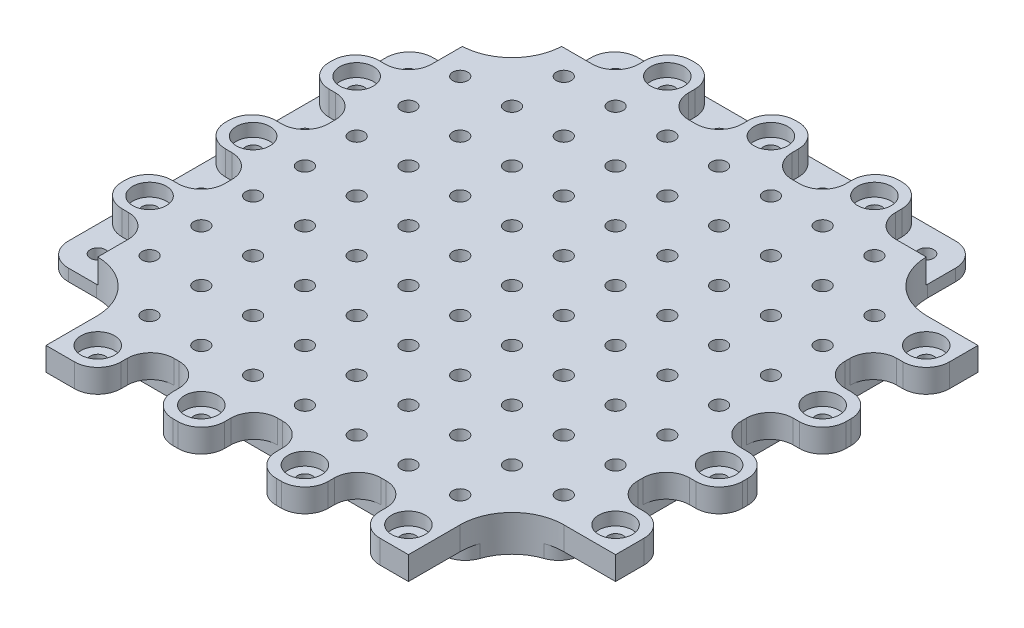
from build123d import *

# Parameters (mm, degrees)
CROQUIS1_W              = 100
CROQUIS1_H              = 100
SALIENTE_EXTRUIR1_DEPTH = 7
CROQUIS2_W              = 10.400000000000006
CROQUIS2_H              = 10.399999999999999
CROQUIS2_W_2            = 10.399999999999999
CROQUIS2_H_2            = 10.400000000000002
CORTAR_EXTRUIR1_DEPTH   = 4.7
CROQUIS3_W              = 9.999999999999986
CROQUIS3_H              = 10.000000000000004
CROQUIS3_W_2            = 10
CROQUIS3_H_2            = 10
CROQUIS3_W_3            = 10.000000000000007
CROQUIS3_H_3            = 10.000000000000002
CROQUIS3_W_4            = 10.000000000000004
CROQUIS3_H_4            = 10.000000000000014
CROQUIS3_W_5            = 10.000000000000002
SALIENTE_EXTRUIR2_DEPTH = 4.5
CROQUIS4_R              = 1.45
CORTAR_EXTRUIR2_DEPTH   = 7
CROQUIS5_R              = 3.2500000000000013
CORTAR_EXTRUIR4_DEPTH   = 2.5
CROQUIS6_W              = 10.000000000000007
CROQUIS6_H              = 0.19999999999999574
CROQUIS6_W_2            = 10.000000000000009
CROQUIS6_H_2            = 0.20000000000000284
CROQUIS6_W_3            = 10.00000000000001
CORTAR_EXTRUIR5_DEPTH   = 7
CROQUIS8_W              = 10.199999999999442
CROQUIS8_H              = 10
CORTAR_EXTRUIR7_DEPTH   = 7
CROQUIS9_W              = 10.012239445081292
CROQUIS9_H              = 0.19999999999999574
CROQUIS9_W_2            = 10.012239445081295
CROQUIS9_W_3            = 10.01223944508129
CROQUIS9_W_4            = 10.012239445081288
CORTAR_EXTRUIR9_DEPTH   = 2.5
CORTAR_EXTRUIR11_DEPTH  = 5
CROQUIS11_W             = 10
CROQUIS11_H             = 10.199999999999449
CROQUIS11_W_2           = 10.200000000000003
CROQUIS11_H_2           = 10.199999999999996
CORTAR_EXTRUIR12_DEPTH  = 10
CROQUIS12_W             = 19.800000000000004
CROQUIS12_H             = 19.8
CROQUIS12_W_2           = 9.800000000000836
CROQUIS12_H_2           = 20.000000000000014
CROQUIS12_W_3           = 20.00000000000001
CROQUIS12_H_3           = 9.600000000000563
CORTAR_EXTRUIR13_DEPTH  = 10
REDONDEO1_R             = 10
REDONDEO2_R             = 4.5
REDONDEO3_R             = 4.5


with BuildPart() as part:
    # Croquis1 → Saliente-Extruir1 (new body)
    with BuildSketch(Plane(origin=(0, 0, 0), x_dir=(1, 0, 0), z_dir=(0, 1, 0))):
        Rectangle(CROQUIS1_W, CROQUIS1_H)
    extrude(amount=SALIENTE_EXTRUIR1_DEPTH)

    # Croquis2 → Cortar-Extruir1 (cut)
    with BuildSketch(Plane(origin=(0, 7, 0), x_dir=(1, 0, 0), z_dir=(0, 1, 0))):
        Polygon((-50.19999999999998, 50.20000000000001), (-39.79999999999998, 50.20000000000001), (-39.79999999999998, 39.80000000000001), (-50.19999999999999, 39.80000000000001), align=None)
        Polygon((-30.19999999999998, 50.20000000000001), (-19.79999999999998, 50.20000000000001), (-19.79999999999998, 39.80000000000001), (-30.19999999999999, 39.80000000000001), align=None)
        Polygon((-10.19999999999998, 50.20000000000001), (0.2000000000000196, 50.20000000000001), (0.2000000000000196, 39.80000000000001), (-10.199999999999987, 39.80000000000001), align=None)
        Polygon((9.800000000000017, 50.20000000000001), (20.200000000000017, 50.20000000000001), (20.200000000000017, 39.80000000000001), (9.80000000000001, 39.80000000000001), align=None)
        Polygon((29.800000000000022, 50.20000000000001), (40.20000000000002, 50.20000000000001), (40.20000000000002, 39.80000000000001), (29.800000000000015, 39.80000000000001), align=None)
        with Locations((-44.99999999999977, 25.000000000000007)):
            Rectangle(CROQUIS2_W, CROQUIS2_H)
        Polygon((-50.19999999999956, 10.200000000000008), (-39.799999999999564, 10.200000000000008), (-39.799999999999564, -0.19999999999999185), (-50.19999999999957, -0.19999999999999185), align=None)
        with Locations((-44.99999999999936, -14.99999999999999)):
            Rectangle(CROQUIS2_W_2, CROQUIS2_H)
        with Locations((-44.99999999999915, -34.99999999999999)):
            Rectangle(CROQUIS2_W_2, CROQUIS2_H_2)
    extrude(amount=-CORTAR_EXTRUIR1_DEPTH, mode=Mode.SUBTRACT)

    # Croquis3 → Saliente-Extruir2 (add)
    with BuildSketch(Plane(origin=(0, 7, 0), x_dir=(1, 0, 0), z_dir=(0, 1, 0))):
        with Locations((55.000000000000234, 25.000000000000007)):
            Rectangle(CROQUIS3_W, CROQUIS3_H)
        with Locations((55.00000000000002, 45.00000000000001)):
            Rectangle(CROQUIS3_W_2, CROQUIS3_H_2)
        with Locations((55.00000000000044, 5.000000000000008)):
            Rectangle(CROQUIS3_W_3, CROQUIS3_H_3)
        with Locations((55.00000000000065, -14.99999999999999)):
            Rectangle(CROQUIS3_W_2, CROQUIS3_H_3)
        with Locations((55.00000000000087, -34.99999999999999)):
            Rectangle(CROQUIS3_W_2, CROQUIS3_H_2)
        with Locations((-24.99999999999998, -55)):
            Rectangle(CROQUIS3_W_4, CROQUIS3_H_4)
        with Locations((-44.999999999999986, -55)):
            Rectangle(CROQUIS3_W_3, CROQUIS3_H_4)
        with Locations((-4.99999999999998, -55)):
            Rectangle(CROQUIS3_W_5, CROQUIS3_H_4)
        with Locations((15.000000000000018, -55)):
            Rectangle(CROQUIS3_W_5, CROQUIS3_H_4)
        with Locations((35.00000000000002, -55)):
            Rectangle(CROQUIS3_W_2, CROQUIS3_H_4)
    extrude(amount=-SALIENTE_EXTRUIR2_DEPTH)

    # Croquis4 → Cortar-Extruir2 (cut)
    with BuildSketch(Plane(origin=(0, 7, 0), x_dir=(1, 0, 0), z_dir=(0, 1, 0))):
        with Locations(Location((-44.999999999999986, 45.000000000000014, 0), (0, 0, 270))):
            Circle(CROQUIS4_R)
        with Locations(Location((-34.999999999999986, 45.000000000000014, 0), (0, 0, 270))):
            Circle(CROQUIS4_R)
        with Locations(Location((-24.999999999999986, 45.000000000000014, 0), (0, 0, 270))):
            Circle(CROQUIS4_R)
        with Locations(Location((-14.999999999999986, 45.000000000000014, 0), (0, 0, 270))):
            Circle(CROQUIS4_R)
        with Locations(Location((-4.999999999999984, 45.000000000000014, 0), (0, 0, 270))):
            Circle(CROQUIS4_R)
        with Locations(Location((5.000000000000019, 45.000000000000014, 0), (0, 0, 270))):
            Circle(CROQUIS4_R)
        with Locations(Location((15.000000000000014, 45.000000000000014, 0), (0, 0, 270))):
            Circle(CROQUIS4_R)
        with Locations(Location((25.00000000000002, 45.000000000000014, 0), (0, 0, 270))):
            Circle(CROQUIS4_R)
        with Locations(Location((35.000000000000014, 45.000000000000014, 0), (0, 0, 270))):
            Circle(CROQUIS4_R)
        with Locations(Location((45.000000000000014, 45.000000000000014, 0), (0, 0, 270))):
            Circle(CROQUIS4_R)
        with Locations(Location((55.00000000000002, 45.000000000000014, 0), (0, 0, 270))):
            Circle(CROQUIS4_R)
        with Locations(Location((-34.99999999999988, 35.00000000000001, 0), (0, 0, 270))):
            Circle(CROQUIS4_R)
        with Locations(Location((-24.99999999999988, 35.00000000000001, 0), (0, 0, 270))):
            Circle(CROQUIS4_R)
        with Locations(Location((-14.999999999999881, 35.00000000000001, 0), (0, 0, 270))):
            Circle(CROQUIS4_R)
        with Locations(Location((-4.999999999999879, 35.00000000000001, 0), (0, 0, 270))):
            Circle(CROQUIS4_R)
        with Locations(Location((5.000000000000123, 35.00000000000001, 0), (0, 0, 270))):
            Circle(CROQUIS4_R)
        with Locations(Location((15.000000000000117, 35.00000000000001, 0), (0, 0, 270))):
            Circle(CROQUIS4_R)
        with Locations(Location((25.000000000000135, 35.00000000000001, 0), (0, 0, 270))):
            Circle(CROQUIS4_R)
        with Locations(Location((35.00000000000013, 35.00000000000001, 0), (0, 0, 270))):
            Circle(CROQUIS4_R)
        with Locations(Location((45.00000000000012, 35.00000000000001, 0), (0, 0, 270))):
            Circle(CROQUIS4_R)
        with Locations((55.000000000000135, 35.00000000000001)):
            Circle(CROQUIS4_R)
        with Locations(Location((-34.99999999999977, 25.00000000000001, 0), (0, 0, 270))):
            Circle(CROQUIS4_R)
        with Locations(Location((-24.999999999999776, 25.00000000000001, 0), (0, 0, 270))):
            Circle(CROQUIS4_R)
        with Locations(Location((-14.999999999999778, 25.00000000000001, 0), (0, 0, 270))):
            Circle(CROQUIS4_R)
        with Locations(Location((-4.999999999999775, 25.00000000000001, 0), (0, 0, 270))):
            Circle(CROQUIS4_R)
        with Locations(Location((5.0000000000002265, 25.00000000000001, 0), (0, 0, 270))):
            Circle(CROQUIS4_R)
        with Locations(Location((15.000000000000222, 25.00000000000001, 0), (0, 0, 270))):
            Circle(CROQUIS4_R)
        with Locations(Location((25.00000000000023, 25.00000000000001, 0), (0, 0, 270))):
            Circle(CROQUIS4_R)
        with Locations(Location((35.00000000000023, 25.00000000000001, 0), (0, 0, 270))):
            Circle(CROQUIS4_R)
        with Locations(Location((45.00000000000022, 25.00000000000001, 0), (0, 0, 270))):
            Circle(CROQUIS4_R)
        with Locations(Location((55.00000000000023, 25.00000000000001, 0), (0, 0, 270))):
            Circle(CROQUIS4_R)
        with Locations(Location((-34.99999999999967, 15.000000000000014, 0), (0, 0, 270))):
            Circle(CROQUIS4_R)
        with Locations(Location((-24.999999999999673, 15.000000000000014, 0), (0, 0, 270))):
            Circle(CROQUIS4_R)
        with Locations(Location((-14.999999999999673, 15.000000000000014, 0), (0, 0, 270))):
            Circle(CROQUIS4_R)
        with Locations(Location((-4.999999999999671, 15.000000000000014, 0), (0, 0, 270))):
            Circle(CROQUIS4_R)
        with Locations(Location((5.00000000000033, 15.000000000000014, 0), (0, 0, 270))):
            Circle(CROQUIS4_R)
        with Locations(Location((15.000000000000325, 15.000000000000014, 0), (0, 0, 270))):
            Circle(CROQUIS4_R)
        with Locations(Location((25.00000000000034, 15.000000000000014, 0), (0, 0, 270))):
            Circle(CROQUIS4_R)
        with Locations(Location((35.000000000000334, 15.000000000000014, 0), (0, 0, 270))):
            Circle(CROQUIS4_R)
        with Locations(Location((45.000000000000334, 15.000000000000014, 0), (0, 0, 270))):
            Circle(CROQUIS4_R)
        with Locations((55.00000000000034, 15.000000000000014)):
            Circle(CROQUIS4_R)
        with Locations(Location((-34.99999999999957, 5.0000000000000115, 0), (0, 0, 270))):
            Circle(CROQUIS4_R)
        with Locations(Location((-24.999999999999567, 5.0000000000000115, 0), (0, 0, 270))):
            Circle(CROQUIS4_R)
        with Locations(Location((-14.99999999999957, 5.0000000000000115, 0), (0, 0, 270))):
            Circle(CROQUIS4_R)
        with Locations(Location((-4.9999999999995675, 5.0000000000000115, 0), (0, 0, 270))):
            Circle(CROQUIS4_R)
        with Locations(Location((5.000000000000434, 5.0000000000000115, 0), (0, 0, 270))):
            Circle(CROQUIS4_R)
        with Locations(Location((15.00000000000043, 5.0000000000000115, 0), (0, 0, 270))):
            Circle(CROQUIS4_R)
        with Locations(Location((25.000000000000437, 5.0000000000000115, 0), (0, 0, 270))):
            Circle(CROQUIS4_R)
        with Locations(Location((35.00000000000043, 5.0000000000000115, 0), (0, 0, 270))):
            Circle(CROQUIS4_R)
        with Locations(Location((45.000000000000426, 5.0000000000000115, 0), (0, 0, 270))):
            Circle(CROQUIS4_R)
        with Locations(Location((55.00000000000044, 5.0000000000000115, 0), (0, 0, 270))):
            Circle(CROQUIS4_R)
        with Locations(Location((-34.99999999999946, -4.99999999999999, 0), (0, 0, 270))):
            Circle(CROQUIS4_R)
        with Locations(Location((-24.999999999999464, -4.99999999999999, 0), (0, 0, 270))):
            Circle(CROQUIS4_R)
        with Locations(Location((-14.999999999999465, -4.99999999999999, 0), (0, 0, 270))):
            Circle(CROQUIS4_R)
        with Locations(Location((-4.9999999999994635, -4.99999999999999, 0), (0, 0, 270))):
            Circle(CROQUIS4_R)
        with Locations(Location((5.000000000000539, -4.99999999999999, 0), (0, 0, 270))):
            Circle(CROQUIS4_R)
        with Locations(Location((15.000000000000533, -4.99999999999999, 0), (0, 0, 270))):
            Circle(CROQUIS4_R)
        with Locations(Location((25.00000000000055, -4.99999999999999, 0), (0, 0, 270))):
            Circle(CROQUIS4_R)
        with Locations(Location((35.00000000000055, -4.99999999999999, 0), (0, 0, 270))):
            Circle(CROQUIS4_R)
        with Locations(Location((45.00000000000054, -4.99999999999999, 0), (0, 0, 270))):
            Circle(CROQUIS4_R)
        with Locations((55.00000000000055, -4.99999999999999)):
            Circle(CROQUIS4_R)
        with Locations(Location((-34.99999999999936, -14.999999999999986, 0), (0, 0, 270))):
            Circle(CROQUIS4_R)
        with Locations(Location((-24.99999999999936, -14.999999999999986, 0), (0, 0, 270))):
            Circle(CROQUIS4_R)
        with Locations(Location((-14.99999999999936, -14.999999999999986, 0), (0, 0, 270))):
            Circle(CROQUIS4_R)
        with Locations(Location((-4.999999999999359, -14.999999999999986, 0), (0, 0, 270))):
            Circle(CROQUIS4_R)
        with Locations(Location((5.000000000000643, -14.999999999999986, 0), (0, 0, 270))):
            Circle(CROQUIS4_R)
        with Locations(Location((15.000000000000638, -14.999999999999986, 0), (0, 0, 270))):
            Circle(CROQUIS4_R)
        with Locations(Location((25.000000000000647, -14.999999999999986, 0), (0, 0, 270))):
            Circle(CROQUIS4_R)
        with Locations(Location((35.00000000000064, -14.999999999999986, 0), (0, 0, 270))):
            Circle(CROQUIS4_R)
        with Locations(Location((45.00000000000064, -14.999999999999986, 0), (0, 0, 270))):
            Circle(CROQUIS4_R)
        with Locations(Location((55.00000000000065, -14.999999999999986, 0), (0, 0, 270))):
            Circle(CROQUIS4_R)
        with Locations(Location((-34.999999999999254, -24.999999999999993, 0), (0, 0, 270))):
            Circle(CROQUIS4_R)
        with Locations(Location((-24.999999999999254, -24.999999999999993, 0), (0, 0, 270))):
            Circle(CROQUIS4_R)
        with Locations(Location((-14.999999999999257, -24.999999999999993, 0), (0, 0, 270))):
            Circle(CROQUIS4_R)
        with Locations(Location((-4.999999999999255, -24.999999999999993, 0), (0, 0, 270))):
            Circle(CROQUIS4_R)
        with Locations(Location((5.000000000000747, -24.999999999999993, 0), (0, 0, 270))):
            Circle(CROQUIS4_R)
        with Locations(Location((15.000000000000743, -24.999999999999993, 0), (0, 0, 270))):
            Circle(CROQUIS4_R)
        with Locations(Location((25.000000000000757, -24.999999999999993, 0), (0, 0, 270))):
            Circle(CROQUIS4_R)
        with Locations(Location((35.00000000000075, -24.999999999999993, 0), (0, 0, 270))):
            Circle(CROQUIS4_R)
        with Locations(Location((45.000000000000746, -24.999999999999993, 0), (0, 0, 270))):
            Circle(CROQUIS4_R)
        with Locations((55.00000000000075, -24.999999999999993)):
            Circle(CROQUIS4_R)
        with Locations(Location((-34.99999999999915, -34.99999999999999, 0), (0, 0, 270))):
            Circle(CROQUIS4_R)
        with Locations(Location((-24.99999999999915, -34.99999999999999, 0), (0, 0, 270))):
            Circle(CROQUIS4_R)
        with Locations(Location((-14.999999999999153, -34.99999999999999, 0), (0, 0, 270))):
            Circle(CROQUIS4_R)
        with Locations(Location((-4.999999999999151, -34.99999999999999, 0), (0, 0, 270))):
            Circle(CROQUIS4_R)
        with Locations(Location((5.000000000000851, -34.99999999999999, 0), (0, 0, 270))):
            Circle(CROQUIS4_R)
        with Locations(Location((15.000000000000846, -34.99999999999999, 0), (0, 0, 270))):
            Circle(CROQUIS4_R)
        with Locations(Location((25.000000000000856, -34.99999999999999, 0), (0, 0, 270))):
            Circle(CROQUIS4_R)
        with Locations(Location((35.00000000000085, -34.99999999999999, 0), (0, 0, 270))):
            Circle(CROQUIS4_R)
        with Locations(Location((45.000000000000846, -34.99999999999999, 0), (0, 0, 270))):
            Circle(CROQUIS4_R)
        with Locations(Location((55.00000000000085, -34.99999999999999, 0), (0, 0, 270))):
            Circle(CROQUIS4_R)
        with Locations(Location((-34.99999999999905, -44.999999999999986, 0), (0, 0, 270))):
            Circle(CROQUIS4_R)
        with Locations(Location((-24.999999999999048, -44.999999999999986, 0), (0, 0, 270))):
            Circle(CROQUIS4_R)
        with Locations(Location((-14.99999999999905, -44.999999999999986, 0), (0, 0, 270))):
            Circle(CROQUIS4_R)
        with Locations(Location((-4.999999999999047, -44.999999999999986, 0), (0, 0, 270))):
            Circle(CROQUIS4_R)
        with Locations(Location((5.000000000000955, -44.999999999999986, 0), (0, 0, 270))):
            Circle(CROQUIS4_R)
        with Locations(Location((15.00000000000095, -44.999999999999986, 0), (0, 0, 270))):
            Circle(CROQUIS4_R)
        with Locations(Location((25.000000000000966, -44.999999999999986, 0), (0, 0, 270))):
            Circle(CROQUIS4_R)
        with Locations(Location((35.00000000000096, -44.999999999999986, 0), (0, 0, 270))):
            Circle(CROQUIS4_R)
        with Locations(Location((45.00000000000096, -44.999999999999986, 0), (0, 0, 270))):
            Circle(CROQUIS4_R)
        with Locations((55.000000000000966, -44.999999999999986)):
            Circle(CROQUIS4_R)
        with Locations((-34.99999999999894, -54.99999999999999)):
            Circle(CROQUIS4_R)
        with Locations(Location((-24.999999999998945, -54.99999999999999, 0), (0, 0, 270))):
            Circle(CROQUIS4_R)
        with Locations((-14.999999999998945, -54.99999999999999)):
            Circle(CROQUIS4_R)
        with Locations(Location((-4.999999999998943, -54.99999999999999, 0), (0, 0, 270))):
            Circle(CROQUIS4_R)
        with Locations((5.000000000001059, -54.99999999999999)):
            Circle(CROQUIS4_R)
        with Locations(Location((15.000000000001053, -54.99999999999999, 0), (0, 0, 270))):
            Circle(CROQUIS4_R)
        with Locations((25.000000000001062, -54.99999999999999)):
            Circle(CROQUIS4_R)
        with Locations(Location((35.00000000000106, -54.99999999999999, 0), (0, 0, 270))):
            Circle(CROQUIS4_R)
        with Locations((45.00000000000105, -54.99999999999999)):
            Circle(CROQUIS4_R)
        with Locations((55.00000000000106, -54.99999999999999)):
            Circle(CROQUIS4_R)
        with Locations(Location((-44.99999999999988, 35.00000000000001, 0), (0, 0, 270))):
            Circle(CROQUIS4_R)
        with Locations(Location((-44.99999999999978, 25.00000000000001, 0), (0, 0, 270))):
            Circle(CROQUIS4_R)
        with Locations(Location((-44.99999999999967, 15.000000000000014, 0), (0, 0, 270))):
            Circle(CROQUIS4_R)
        with Locations(Location((-44.99999999999957, 5.0000000000000115, 0), (0, 0, 270))):
            Circle(CROQUIS4_R)
        with Locations(Location((-44.99999999999947, -4.99999999999999, 0), (0, 0, 270))):
            Circle(CROQUIS4_R)
        with Locations(Location((-44.99999999999936, -14.999999999999986, 0), (0, 0, 270))):
            Circle(CROQUIS4_R)
        with Locations(Location((-44.999999999999254, -24.999999999999993, 0), (0, 0, 270))):
            Circle(CROQUIS4_R)
        with Locations(Location((-44.999999999999154, -34.99999999999999, 0), (0, 0, 270))):
            Circle(CROQUIS4_R)
        with Locations(Location((-44.99999999999905, -44.999999999999986, 0), (0, 0, 270))):
            Circle(CROQUIS4_R)
        with Locations(Location((-44.99999999999894, -54.99999999999999, 0), (0, 0, 270))):
            Circle(CROQUIS4_R)
    extrude(amount=-CORTAR_EXTRUIR2_DEPTH, mode=Mode.SUBTRACT)

    # Croquis5 → Cortar-Extruir4 (cut)
    with BuildSketch(Plane(origin=(0, 7, 0), x_dir=(1, 0, 0), z_dir=(0, 1, 0))):
        with Locations((-44.999999999999986, 45.000000000000014)):
            Circle(CROQUIS5_R)
        with Locations(Location((-34.999999999999986, 45.000000000000014, 0), (0, 0, 270))):
            Circle(CROQUIS5_R)
        with Locations((-24.999999999999986, 45.000000000000014)):
            Circle(CROQUIS5_R)
        with Locations(Location((-14.999999999999986, 45.000000000000014, 0), (0, 0, 270))):
            Circle(CROQUIS5_R)
        with Locations((-4.999999999999984, 45.000000000000014)):
            Circle(CROQUIS5_R)
        with Locations(Location((5.000000000000019, 45.000000000000014, 0), (0, 0, 270))):
            Circle(CROQUIS5_R)
        with Locations((15.000000000000014, 45.000000000000014)):
            Circle(CROQUIS5_R)
        with Locations(Location((25.00000000000002, 45.000000000000014, 0), (0, 0, 270))):
            Circle(CROQUIS5_R)
        with Locations((35.000000000000014, 45.000000000000014)):
            Circle(CROQUIS5_R)
        with Locations(Location((45.000000000000014, 45.000000000000014, 0), (0, 0, 270))):
            Circle(CROQUIS5_R)
        with Locations(Location((55.00000000000002, 45.000000000000014, 0), (0, 0, 270))):
            Circle(CROQUIS5_R)
        with Locations((55.000000000000135, 35.00000000000001)):
            Circle(CROQUIS5_R)
        with Locations(Location((55.00000000000023, 25.00000000000001, 0), (0, 0, 270))):
            Circle(CROQUIS5_R)
        with Locations((55.00000000000034, 15.000000000000014)):
            Circle(CROQUIS5_R)
        with Locations(Location((55.00000000000044, 5.0000000000000115, 0), (0, 0, 270))):
            Circle(CROQUIS5_R)
        with Locations((55.00000000000055, -4.99999999999999)):
            Circle(CROQUIS5_R)
        with Locations(Location((55.00000000000065, -14.999999999999986, 0), (0, 0, 270))):
            Circle(CROQUIS5_R)
        with Locations((55.00000000000075, -24.999999999999993)):
            Circle(CROQUIS5_R)
        with Locations(Location((55.00000000000085, -34.99999999999999, 0), (0, 0, 270))):
            Circle(CROQUIS5_R)
        with Locations((55.000000000000966, -44.999999999999986)):
            Circle(CROQUIS5_R)
        with Locations((-34.99999999999894, -54.99999999999999)):
            Circle(CROQUIS5_R)
        with Locations(Location((-24.999999999998945, -54.99999999999999, 0), (0, 0, 270))):
            Circle(CROQUIS5_R)
        with Locations((-14.999999999998945, -54.99999999999999)):
            Circle(CROQUIS5_R)
        with Locations(Location((-4.999999999998943, -54.99999999999999, 0), (0, 0, 270))):
            Circle(CROQUIS5_R)
        with Locations((5.000000000001059, -54.99999999999999)):
            Circle(CROQUIS5_R)
        with Locations(Location((15.000000000001053, -54.99999999999999, 0), (0, 0, 270))):
            Circle(CROQUIS5_R)
        with Locations((25.000000000001062, -54.99999999999999)):
            Circle(CROQUIS5_R)
        with Locations(Location((35.00000000000106, -54.99999999999999, 0), (0, 0, 270))):
            Circle(CROQUIS5_R)
        with Locations((45.00000000000105, -54.99999999999999)):
            Circle(CROQUIS5_R)
        with Locations((55.00000000000106, -54.99999999999999)):
            Circle(CROQUIS5_R)
        with Locations(Location((-44.99999999999988, 35.00000000000001, 0), (0, 0, 270))):
            Circle(CROQUIS5_R)
        with Locations((-44.99999999999978, 25.00000000000001)):
            Circle(CROQUIS5_R)
        with Locations(Location((-44.99999999999967, 15.000000000000014, 0), (0, 0, 270))):
            Circle(CROQUIS5_R)
        with Locations((-44.99999999999957, 5.0000000000000115)):
            Circle(CROQUIS5_R)
        with Locations(Location((-44.99999999999947, -4.99999999999999, 0), (0, 0, 270))):
            Circle(CROQUIS5_R)
        with Locations((-44.99999999999936, -14.999999999999986)):
            Circle(CROQUIS5_R)
        with Locations(Location((-44.999999999999254, -24.999999999999993, 0), (0, 0, 270))):
            Circle(CROQUIS5_R)
        with Locations((-44.999999999999154, -34.99999999999999)):
            Circle(CROQUIS5_R)
        with Locations(Location((-44.99999999999905, -44.999999999999986, 0), (0, 0, 270))):
            Circle(CROQUIS5_R)
        with Locations(Location((-44.99999999999894, -54.99999999999999, 0), (0, 0, 270))):
            Circle(CROQUIS5_R)
    extrude(amount=-CORTAR_EXTRUIR4_DEPTH, mode=Mode.SUBTRACT)

    # Croquis6 → Cortar-Extruir5 (cut)
    with BuildSketch(Plane(origin=(0, 7, 0), x_dir=(1, 0, 0), z_dir=(0, 1, 0))):
        Polygon((50.00000000000002, -49.99999999999999), (40.000000000000014, -49.99999999999999), (40.000000000000014, -49.8), (49.80000000000086, -49.8), (49.80000000000086, -39.99999999999999), (50.00000000000086, -39.99999999999999), (50.00000000000002, -49.8), align=None)
        with Locations((25.000000000000018, -49.900000000000134)):
            Rectangle(CROQUIS6_W, CROQUIS6_H)
        with Locations((5.000000000000019, -49.90000000000027)):
            Rectangle(CROQUIS6_W_2, CROQUIS6_H_2)
        with Locations((-14.999999999999979, -49.90000000000042)):
            Rectangle(CROQUIS6_W_2, CROQUIS6_H)
        with Locations((-34.99999999999998, -49.90000000000056)):
            Rectangle(CROQUIS6_W_3, CROQUIS6_H)
        Polygon((49.99999999999996, -29.799999999999997), (50.00000000000079, -19.999999999999993), (49.800000000000786, -19.999999999999993), (49.800000000000786, -29.799999999999997), align=None)
        Polygon((49.999999999999886, -9.799999999999995), (50.00000000000072, 6.94e-15), (49.80000000000072, 6.94e-15), (49.80000000000072, -9.799999999999995), align=None)
        Polygon((49.999999999999815, 10.200000000000001), (50.00000000000065, 20.000000000000004), (49.80000000000065, 20.000000000000004), (49.80000000000065, 10.200000000000001), align=None)
        Polygon((49.999999999999744, 30.200000000000003), (50.000000000000576, 40.00000000000001), (49.80000000000058, 40.00000000000001), (49.80000000000058, 30.200000000000003), align=None)
    extrude(amount=-CORTAR_EXTRUIR5_DEPTH, mode=Mode.SUBTRACT)

    # Croquis8 → Cortar-Extruir7 (cut)
    with BuildSketch(Plane(origin=(0, 7, 0), x_dir=(1, 0, 0), z_dir=(0, 1, 0))):
        with Locations((54.900000000000304, 45.00000000000001)):
            Rectangle(CROQUIS8_W, CROQUIS8_H)
    extrude(amount=-CORTAR_EXTRUIR7_DEPTH, mode=Mode.SUBTRACT)

    # Croquis9 → Cortar-Extruir9 (cut)
    with BuildSketch(Plane.XZ):
        with Locations((-45.00611972254063, 49.90000000000056)):
            Rectangle(CROQUIS9_W, CROQUIS9_H)
        with Locations((-25.00611972254063, 49.90000000000056)):
            Rectangle(CROQUIS9_W_2, CROQUIS9_H)
        with Locations((-5.006119722540631, 49.90000000000056)):
            Rectangle(CROQUIS9_W_3, CROQUIS9_H)
        with Locations((14.993880277459365, 49.90000000000056)):
            Rectangle(CROQUIS9_W_3, CROQUIS9_H)
        with Locations((34.99388027745937, 49.90000000000056)):
            Rectangle(CROQUIS9_W_4, CROQUIS9_H)
        Polygon((50.00000000000065, -20.000000000000004), (49.999999999999744, -30.200000000000003), (49.80000000000058, -30.200000000000003), (49.80000000000058, -20.000000000000004), align=None)
        Polygon((50.000000000000576, -3.47e-15), (49.99999999999967, -10.200000000000005), (49.80000000000051, -10.200000000000005), (49.80000000000051, -3.47e-15), align=None)
        Polygon((50.00000000000051, 19.999999999999996), (49.99999999999961, 9.799999999999995), (49.80000000000044, 9.799999999999995), (49.80000000000044, 19.999999999999996), align=None)
        Polygon((50.00000000000044, 39.99999999999999), (49.99999999999954, 29.799999999999994), (49.800000000000374, 29.799999999999994), (49.800000000000374, 39.99999999999999), align=None)
    extrude(amount=-CORTAR_EXTRUIR9_DEPTH, mode=Mode.SUBTRACT)

    # Croquis10 → Cortar-Extruir11 (cut)
    with BuildSketch(Plane.XZ.offset(-2.5000000000000004)):
        Polygon((49.99999999999956, 29.999999999999993), (49.99999999999954, 29.799999999999994), (49.80000000000057, 29.799999999999994), (49.80000000000057, 29.999999999999993), align=None)
        Polygon((49.999999999999766, 9.999999999999991), (49.999999999999744, 9.799999999999994), (49.80000000000078, 9.799999999999994), (49.80000000000078, 9.999999999999991), align=None)
        Polygon((49.99999999999997, -10.000000000000009), (49.99999999999996, -10.200000000000008), (49.80000000000099, -10.200000000000008), (49.80000000000099, -10.000000000000009), align=None)
        Polygon((50.000000000000185, -30.000000000000007), (50.00000000000016, -30.200000000000003), (49.8000000000012, -30.200000000000003), (49.8000000000012, -30.000000000000007), align=None)
    extrude(amount=-CORTAR_EXTRUIR11_DEPTH, mode=Mode.SUBTRACT)

    # Croquis11 → Cortar-Extruir12 (cut)
    with BuildSketch(Plane(origin=(0, 7, 0), x_dir=(1, 0, 0), z_dir=(0, 1, 0))):
        with Locations((-44.999999999999986, -54.90000000000028)):
            Rectangle(CROQUIS11_W, CROQUIS11_H)
        with Locations((-44.899999999999984, 44.900000000000006)):
            Rectangle(CROQUIS11_W_2, CROQUIS11_H_2)
    extrude(amount=-CORTAR_EXTRUIR12_DEPTH, mode=Mode.SUBTRACT)

    # Croquis12 → Cortar-Extruir13 (cut)
    with BuildSketch(Plane(origin=(0, 7, 0), x_dir=(1, 0, 0), z_dir=(0, 1, 0))):
        with Locations((-40.09999999999998, 40.10000000000001)):
            Rectangle(CROQUIS12_W, CROQUIS12_H)
        Polygon((40.20000000000002, 50.00000000000001), (49.80000000000058, 50.00000000000001), (49.8000000000012, 30.000000000000007), (40.200000000000024, 30.00000000000001), align=None)
        with Locations((44.90000000000044, -50)):
            Rectangle(CROQUIS12_W_2, CROQUIS12_H_2)
        with Locations((-39.99999999999998, -45.00000000000028)):
            Rectangle(CROQUIS12_W_3, CROQUIS12_H_3)
    extrude(amount=-CORTAR_EXTRUIR13_DEPTH, mode=Mode.SUBTRACT)

    # Redondeo1
    # the kernel refuses this fillet: 10 mm, written as the material it adds along each edge
    with BuildSketch(Plane(origin=(-29.99999999999998, 7, 40.199999999999996), x_dir=(0, 0, 1), z_dir=(0, -1, 0))) as redondeo1_piece_1_section:
        with BuildLine():
            CenterArc((REDONDEO1_R, REDONDEO1_R), REDONDEO1_R, 180, 90)
            Line((0, REDONDEO1_R), (0, 0))
            Line((0, 0), (REDONDEO1_R, 0))
        make_face()
    redondeo1_piece_1 = extrude(amount=7, mode=Mode.PRIVATE)
    redondeo1_piece_1 = split(redondeo1_piece_1, bisect_by=Plane(origin=(-29.901347698191934, 4.750000000000007, 49.80000000000056), z_dir=(0, 0, 1)), keep=Keep.TOP, mode=Mode.PRIVATE)
    redondeo1_piece_1 = split(redondeo1_piece_1, bisect_by=Plane(origin=(-29.901347698191934, 2.5, 49.998683793361884), z_dir=(0, 1, 0)), keep=Keep.TOP, mode=Mode.PRIVATE)
    add(redondeo1_piece_1)
    with BuildSketch(Plane(origin=(-29.99999999999998, 7, 40.199999999999996), x_dir=(0, 0, 1), z_dir=(0, -1, 0))) as redondeo1_piece_2_section:
        with BuildLine():
            CenterArc((REDONDEO1_R, REDONDEO1_R), REDONDEO1_R, 180, 90)
            Line((0, REDONDEO1_R), (0, 0))
            Line((0, 0), (REDONDEO1_R, 0))
        make_face()
    redondeo1_piece_2 = extrude(amount=7, mode=Mode.PRIVATE)
    redondeo1_piece_2 = split(redondeo1_piece_2, bisect_by=Plane(origin=(-32.259422809315616, 4.750000000000001, 49.80000000000056), z_dir=(0, 0, -1)), keep=Keep.TOP, mode=Mode.PRIVATE)
    redondeo1_piece_2 = split(redondeo1_piece_2, bisect_by=Plane(origin=(-32.259422809315616, 2.5, 42.44362102391626), z_dir=(0, 1, 0)), keep=Keep.TOP, mode=Mode.PRIVATE)
    redondeo1_piece_2 = split(redondeo1_piece_2, bisect_by=Plane(origin=(-39.79999999999915, 4.750000000000001, 42.44362102391626), z_dir=(1, 0, 0)), keep=Keep.TOP, mode=Mode.PRIVATE)
    add(redondeo1_piece_2)
    with BuildSketch(Plane(origin=(-29.99999999999998, 7, 40.199999999999996), x_dir=(0, 0, 1), z_dir=(0, -1, 0))) as redondeo1_piece_3_section:
        with BuildLine():
            CenterArc((REDONDEO1_R, REDONDEO1_R), REDONDEO1_R, 180, 90)
            Line((0, REDONDEO1_R), (0, 0))
            Line((0, 0), (REDONDEO1_R, 0))
        make_face()
    redondeo1_piece_3 = extrude(amount=7, mode=Mode.PRIVATE)
    redondeo1_piece_3 = split(redondeo1_piece_3, bisect_by=Plane(origin=(-32.25942280931561, 2.3999999999999995, 49.80000000000056), z_dir=(0, 0, -1)), keep=Keep.TOP, mode=Mode.PRIVATE)
    redondeo1_piece_3 = split(redondeo1_piece_3, bisect_by=Plane(origin=(-32.25942280931561, 2.5, 42.44362102391624), z_dir=(0, -1, 0)), keep=Keep.TOP, mode=Mode.PRIVATE)
    redondeo1_piece_3 = split(redondeo1_piece_3, bisect_by=Plane(origin=(-39.79999999999915, 2.3999999999999995, 42.44362102391624), z_dir=(1, 0, 0)), keep=Keep.TOP, mode=Mode.PRIVATE)
    redondeo1_piece_3 = split(redondeo1_piece_3, bisect_by=Plane(origin=(-32.25942280931561, 2.3, 42.44362102391624), z_dir=(0, 1, 0)), keep=Keep.TOP, mode=Mode.PRIVATE)
    add(redondeo1_piece_3)
    with BuildSketch(Plane(origin=(-29.99999999999998, 7, 40.199999999999996), x_dir=(0, 0, 1), z_dir=(0, -1, 0))) as redondeo1_piece_4_section:
        with BuildLine():
            CenterArc((REDONDEO1_R, REDONDEO1_R), REDONDEO1_R, 180, 90)
            Line((0, REDONDEO1_R), (0, 0))
            Line((0, 0), (REDONDEO1_R, 0))
        make_face()
    redondeo1_piece_4 = extrude(amount=7, mode=Mode.PRIVATE)
    redondeo1_piece_4 = split(redondeo1_piece_4, bisect_by=Plane(origin=(-32.25942280931561, 1.1500000000000001, 49.80000000000056), z_dir=(0, 0, -1)), keep=Keep.TOP, mode=Mode.PRIVATE)
    redondeo1_piece_4 = split(redondeo1_piece_4, bisect_by=Plane(origin=(-39.79999999999915, 1.1500000000000004, 42.44362102391625), z_dir=(1, 0, 0)), keep=Keep.TOP, mode=Mode.PRIVATE)
    redondeo1_piece_4 = split(redondeo1_piece_4, bisect_by=Plane(origin=(-32.25942280931561, 2.3, 42.44362102391625), z_dir=(0, -1, 0)), keep=Keep.TOP, mode=Mode.PRIVATE)
    add(redondeo1_piece_4)
    with BuildSketch(Plane(origin=(-29.99999999999998, 7, 40.199999999999996), x_dir=(0, 0, 1), z_dir=(0, -1, 0))) as redondeo1_piece_5_section:
        with BuildLine():
            CenterArc((REDONDEO1_R, REDONDEO1_R), REDONDEO1_R, 180, 90)
            Line((0, REDONDEO1_R), (0, 0))
            Line((0, 0), (REDONDEO1_R, 0))
        make_face()
    redondeo1_piece_5 = extrude(amount=7, mode=Mode.PRIVATE)
    redondeo1_piece_5 = split(redondeo1_piece_5, bisect_by=Plane(origin=(-39.79999999999915, 1.149999999999996, 40.10033423942369), z_dir=(-1, 0, 0)), keep=Keep.TOP, mode=Mode.PRIVATE)
    redondeo1_piece_5 = split(redondeo1_piece_5, bisect_by=Plane(origin=(-39.89983387378471, 2.3, 40.10033423942369), z_dir=(0, -1, 0)), keep=Keep.TOP, mode=Mode.PRIVATE)
    add(redondeo1_piece_5)
    with BuildSketch(Plane(origin=(40.00000000000002, 7, 39.99999999999999), x_dir=(0, 0, 1), z_dir=(0, -1, 0))) as redondeo1_piece_6_section:
        with BuildLine():
            CenterArc((REDONDEO1_R, -REDONDEO1_R), REDONDEO1_R, 90, 90)
            Line((0, -REDONDEO1_R), (0, 0))
            Line((0, 0), (REDONDEO1_R, 0))
        make_face()
    redondeo1_piece_6 = extrude(amount=7, mode=Mode.PRIVATE)
    redondeo1_piece_6 = split(redondeo1_piece_6, bisect_by=Plane(origin=(39.900334239423714, 4.749999999999927, 49.80000000000056), z_dir=(0, 0, 1)), keep=Keep.TOP, mode=Mode.PRIVATE)
    redondeo1_piece_6 = split(redondeo1_piece_6, bisect_by=Plane(origin=(39.90033423942371, 2.5, 49.89983387378541), z_dir=(0, 1, 0)), keep=Keep.TOP, mode=Mode.PRIVATE)
    add(redondeo1_piece_6)
    with BuildSketch(Plane(origin=(40.00000000000002, 7, 39.99999999999999), x_dir=(0, 0, 1), z_dir=(0, -1, 0))) as redondeo1_piece_7_section:
        with BuildLine():
            CenterArc((REDONDEO1_R, -REDONDEO1_R), REDONDEO1_R, 90, 90)
            Line((0, -REDONDEO1_R), (0, 0))
            Line((0, 0), (REDONDEO1_R, 0))
        make_face()
    redondeo1_piece_7 = extrude(amount=7, mode=Mode.PRIVATE)
    redondeo1_piece_7 = split(redondeo1_piece_7, bisect_by=Plane(origin=(42.255627211309175, 4.750000000000006, 49.80000000000056), z_dir=(0, 0, -1)), keep=Keep.TOP, mode=Mode.PRIVATE)
    redondeo1_piece_7 = split(redondeo1_piece_7, bisect_by=Plane(origin=(42.25562721130917, 2.5, 42.255627211309125), z_dir=(0, 1, 0)), keep=Keep.TOP, mode=Mode.PRIVATE)
    redondeo1_piece_7 = split(redondeo1_piece_7, bisect_by=Plane(origin=(49.80000000000058, 4.750000000000006, 42.255627211309125), z_dir=(-1, 0, 0)), keep=Keep.TOP, mode=Mode.PRIVATE)
    add(redondeo1_piece_7)
    with BuildSketch(Plane(origin=(40.00000000000002, 7, 39.99999999999999), x_dir=(0, 0, 1), z_dir=(0, -1, 0))) as redondeo1_piece_8_section:
        with BuildLine():
            CenterArc((REDONDEO1_R, -REDONDEO1_R), REDONDEO1_R, 90, 90)
            Line((0, -REDONDEO1_R), (0, 0))
            Line((0, 0), (REDONDEO1_R, 0))
        make_face()
    redondeo1_piece_8 = extrude(amount=7, mode=Mode.PRIVATE)
    redondeo1_piece_8 = split(redondeo1_piece_8, bisect_by=Plane(origin=(49.899833873785425, 2.5, 39.900334239423685), z_dir=(0, 1, 0)), keep=Keep.TOP, mode=Mode.PRIVATE)
    redondeo1_piece_8 = split(redondeo1_piece_8, bisect_by=Plane(origin=(49.80000000000058, 4.749999999999995, 39.90033423942369), z_dir=(1, 0, 0)), keep=Keep.TOP, mode=Mode.PRIVATE)
    add(redondeo1_piece_8)
    with BuildSketch(Plane(origin=(40.00000000000002, 7, 39.99999999999999), x_dir=(0, 0, 1), z_dir=(0, -1, 0))) as redondeo1_piece_9_section:
        with BuildLine():
            CenterArc((REDONDEO1_R, -REDONDEO1_R), REDONDEO1_R, 90, 90)
            Line((0, -REDONDEO1_R), (0, 0))
            Line((0, 0), (REDONDEO1_R, 0))
        make_face()
    redondeo1_piece_9 = extrude(amount=7, mode=Mode.PRIVATE)
    redondeo1_piece_9 = split(redondeo1_piece_9, bisect_by=Plane(origin=(42.255627211309175, 1.2499999999999964, 49.80000000000056), z_dir=(0, 0, -1)), keep=Keep.TOP, mode=Mode.PRIVATE)
    redondeo1_piece_9 = split(redondeo1_piece_9, bisect_by=Plane(origin=(42.25562721130917, 2.5, 42.255627211309125), z_dir=(0, -1, 0)), keep=Keep.TOP, mode=Mode.PRIVATE)
    redondeo1_piece_9 = split(redondeo1_piece_9, bisect_by=Plane(origin=(49.80000000000058, 1.2499999999999964, 42.255627211309125), z_dir=(-1, 0, 0)), keep=Keep.TOP, mode=Mode.PRIVATE)
    add(redondeo1_piece_9)
    with BuildSketch(Plane(origin=(-30.19999999999998, 7, -30.200000000000006), x_dir=(0, 0, -1), z_dir=(0, -1, 0))) as redondeo1_piece_10_section:
        with BuildLine():
            CenterArc((REDONDEO1_R, -REDONDEO1_R), REDONDEO1_R, 90, 90)
            Line((-3.55e-15, -REDONDEO1_R), (0, 0))
            Line((0, 0), (REDONDEO1_R, 0))
        make_face()
    redondeo1_piece_10 = extrude(amount=7, mode=Mode.PRIVATE)
    redondeo1_piece_10 = split(redondeo1_piece_10, bisect_by=Plane(origin=(-32.4474033577279, 4.649999999999999, -39.80000000000001), z_dir=(0, 0, 1)), keep=Keep.TOP, mode=Mode.PRIVATE)
    redondeo1_piece_10 = split(redondeo1_piece_10, bisect_by=Plane(origin=(-32.4474033577279, 2.3, -32.44740335772794), z_dir=(0, 1, 0)), keep=Keep.TOP, mode=Mode.PRIVATE)
    redondeo1_piece_10 = split(redondeo1_piece_10, bisect_by=Plane(origin=(-39.79999999999977, 4.649999999999999, -32.44740335772794), z_dir=(1, 0, 0)), keep=Keep.TOP, mode=Mode.PRIVATE)
    add(redondeo1_piece_10)
    with BuildSketch(Plane(origin=(-30.19999999999998, 7, -30.200000000000006), x_dir=(0, 0, -1), z_dir=(0, -1, 0))) as redondeo1_piece_11_section:
        with BuildLine():
            CenterArc((REDONDEO1_R, -REDONDEO1_R), REDONDEO1_R, 90, 90)
            Line((-3.55e-15, -REDONDEO1_R), (0, 0))
            Line((0, 0), (REDONDEO1_R, 0))
        make_face()
    redondeo1_piece_11 = extrude(amount=7, mode=Mode.PRIVATE)
    redondeo1_piece_11 = split(redondeo1_piece_11, bisect_by=Plane(origin=(-30.101347698191933, 1.1499999999999941, -39.80000000000001), z_dir=(0, 0, -1)), keep=Keep.TOP, mode=Mode.PRIVATE)
    redondeo1_piece_11 = split(redondeo1_piece_11, bisect_by=Plane(origin=(-30.101347698191933, 2.3, -39.99868379336161), z_dir=(0, -1, 0)), keep=Keep.TOP, mode=Mode.PRIVATE)
    add(redondeo1_piece_11)
    with BuildSketch(Plane(origin=(-30.19999999999998, 7, -30.200000000000006), x_dir=(0, 0, -1), z_dir=(0, -1, 0))) as redondeo1_piece_12_section:
        with BuildLine():
            CenterArc((REDONDEO1_R, -REDONDEO1_R), REDONDEO1_R, 90, 90)
            Line((-3.55e-15, -REDONDEO1_R), (0, 0))
            Line((0, 0), (REDONDEO1_R, 0))
        make_face()
    redondeo1_piece_12 = extrude(amount=7, mode=Mode.PRIVATE)
    redondeo1_piece_12 = split(redondeo1_piece_12, bisect_by=Plane(origin=(-32.4474033577279, 1.1499999999999995, -39.80000000000001), z_dir=(0, 0, 1)), keep=Keep.TOP, mode=Mode.PRIVATE)
    redondeo1_piece_12 = split(redondeo1_piece_12, bisect_by=Plane(origin=(-32.4474033577279, 2.3, -32.44740335772794), z_dir=(0, -1, 0)), keep=Keep.TOP, mode=Mode.PRIVATE)
    redondeo1_piece_12 = split(redondeo1_piece_12, bisect_by=Plane(origin=(-39.79999999999977, 1.1499999999999995, -32.44740335772794), z_dir=(1, 0, 0)), keep=Keep.TOP, mode=Mode.PRIVATE)
    add(redondeo1_piece_12)
    with BuildSketch(Plane(origin=(-30.19999999999998, 7, -30.200000000000006), x_dir=(0, 0, -1), z_dir=(0, -1, 0))) as redondeo1_piece_13_section:
        with BuildLine():
            CenterArc((REDONDEO1_R, -REDONDEO1_R), REDONDEO1_R, 90, 90)
            Line((-3.55e-15, -REDONDEO1_R), (0, 0))
            Line((0, 0), (REDONDEO1_R, 0))
        make_face()
    redondeo1_piece_13 = extrude(amount=7, mode=Mode.PRIVATE)
    redondeo1_piece_13 = split(redondeo1_piece_13, bisect_by=Plane(origin=(-39.99868379336148, 2.3, -30.10134769819196), z_dir=(0, -1, 0)), keep=Keep.TOP, mode=Mode.PRIVATE)
    redondeo1_piece_13 = split(redondeo1_piece_13, bisect_by=Plane(origin=(-39.79999999999977, 1.1499999999999977, -30.10134769819196), z_dir=(-1, 0, 0)), keep=Keep.TOP, mode=Mode.PRIVATE)
    add(redondeo1_piece_13)
    with BuildSketch(Plane(origin=(40.200000000000024, 7, -30.00000000000001), x_dir=(1, 0, 3.6e-16), z_dir=(0, -1, 0))) as redondeo1_piece_14_section:
        with BuildLine():
            CenterArc((REDONDEO1_R, -REDONDEO1_R), REDONDEO1_R, 90.00000000000003, 89.99999999999991)
            Line((-3.55e-15, -REDONDEO1_R), (0, 0))
            Line((0, 0), (REDONDEO1_R, 0))
        make_face()
    redondeo1_piece_14 = extrude(amount=7, mode=Mode.PRIVATE)
    redondeo1_piece_14 = split(redondeo1_piece_14, bisect_by=Plane(origin=(49.80000000000058, 4.7500000000000036, -29.90134769819196), z_dir=(1, 0, 0)), keep=Keep.TOP, mode=Mode.PRIVATE)
    redondeo1_piece_14 = split(redondeo1_piece_14, bisect_by=Plane(origin=(49.9986837933619, 2.5, -29.90134769819196), z_dir=(0, 1, 0)), keep=Keep.TOP, mode=Mode.PRIVATE)
    add(redondeo1_piece_14)
    with BuildSketch(Plane(origin=(40.200000000000024, 7, -30.00000000000001), x_dir=(1, 0, 3.6e-16), z_dir=(0, -1, 0))) as redondeo1_piece_15_section:
        with BuildLine():
            CenterArc((REDONDEO1_R, -REDONDEO1_R), REDONDEO1_R, 90.00000000000003, 89.99999999999991)
            Line((-3.55e-15, -REDONDEO1_R), (0, 0))
            Line((0, 0), (REDONDEO1_R, 0))
        make_face()
    redondeo1_piece_15 = extrude(amount=7, mode=Mode.PRIVATE)
    redondeo1_piece_15 = split(redondeo1_piece_15, bisect_by=Plane(origin=(49.80000000000058, 4.750000000000007, -32.25942280931568), z_dir=(-1, 0, 0)), keep=Keep.TOP, mode=Mode.PRIVATE)
    redondeo1_piece_15 = split(redondeo1_piece_15, bisect_by=Plane(origin=(42.44362102391626, 2.5, -32.25942280931568), z_dir=(0, 1, 0)), keep=Keep.TOP, mode=Mode.PRIVATE)
    redondeo1_piece_15 = split(redondeo1_piece_15, bisect_by=Plane(origin=(42.44362102391626, 4.750000000000007, -39.80000000000001), z_dir=(0, 0, 1)), keep=Keep.TOP, mode=Mode.PRIVATE)
    add(redondeo1_piece_15)
    with BuildSketch(Plane(origin=(40.200000000000024, 7, -30.00000000000001), x_dir=(1, 0, 3.6e-16), z_dir=(0, -1, 0))) as redondeo1_piece_16_section:
        with BuildLine():
            CenterArc((REDONDEO1_R, -REDONDEO1_R), REDONDEO1_R, 90.00000000000003, 89.99999999999991)
            Line((-3.55e-15, -REDONDEO1_R), (0, 0))
            Line((0, 0), (REDONDEO1_R, 0))
        make_face()
    redondeo1_piece_16 = extrude(amount=7, mode=Mode.PRIVATE)
    redondeo1_piece_16 = split(redondeo1_piece_16, bisect_by=Plane(origin=(49.80000000000058, 2.3999999999999995, -32.25942280931565), z_dir=(-1, 0, 0)), keep=Keep.TOP, mode=Mode.PRIVATE)
    redondeo1_piece_16 = split(redondeo1_piece_16, bisect_by=Plane(origin=(42.44362102391624, 2.5, -32.25942280931565), z_dir=(0, -1, 0)), keep=Keep.TOP, mode=Mode.PRIVATE)
    redondeo1_piece_16 = split(redondeo1_piece_16, bisect_by=Plane(origin=(42.44362102391624, 2.3999999999999995, -39.80000000000001), z_dir=(0, 0, 1)), keep=Keep.TOP, mode=Mode.PRIVATE)
    redondeo1_piece_16 = split(redondeo1_piece_16, bisect_by=Plane(origin=(42.44362102391624, 2.3, -32.25942280931565), z_dir=(0, 1, 0)), keep=Keep.TOP, mode=Mode.PRIVATE)
    add(redondeo1_piece_16)
    with BuildSketch(Plane(origin=(40.200000000000024, 7, -30.00000000000001), x_dir=(1, 0, 3.6e-16), z_dir=(0, -1, 0))) as redondeo1_piece_17_section:
        with BuildLine():
            CenterArc((REDONDEO1_R, -REDONDEO1_R), REDONDEO1_R, 90.00000000000003, 89.99999999999991)
            Line((-3.55e-15, -REDONDEO1_R), (0, 0))
            Line((0, 0), (REDONDEO1_R, 0))
        make_face()
    redondeo1_piece_17 = extrude(amount=7, mode=Mode.PRIVATE)
    redondeo1_piece_17 = split(redondeo1_piece_17, bisect_by=Plane(origin=(49.80000000000058, 1.149999999999996, -32.25942280931567), z_dir=(-1, 0, 0)), keep=Keep.TOP, mode=Mode.PRIVATE)
    redondeo1_piece_17 = split(redondeo1_piece_17, bisect_by=Plane(origin=(42.44362102391625, 1.149999999999996, -39.80000000000001), z_dir=(0, 0, 1)), keep=Keep.TOP, mode=Mode.PRIVATE)
    redondeo1_piece_17 = split(redondeo1_piece_17, bisect_by=Plane(origin=(42.44362102391625, 2.3, -32.25942280931567), z_dir=(0, -1, 0)), keep=Keep.TOP, mode=Mode.PRIVATE)
    add(redondeo1_piece_17)
    with BuildSketch(Plane(origin=(40.200000000000024, 7, -30.00000000000001), x_dir=(1, 0, 3.6e-16), z_dir=(0, -1, 0))) as redondeo1_piece_18_section:
        with BuildLine():
            CenterArc((REDONDEO1_R, -REDONDEO1_R), REDONDEO1_R, 90.00000000000003, 89.99999999999991)
            Line((-3.55e-15, -REDONDEO1_R), (0, 0))
            Line((0, 0), (REDONDEO1_R, 0))
        make_face()
    redondeo1_piece_18 = extrude(amount=7, mode=Mode.PRIVATE)
    redondeo1_piece_18 = split(redondeo1_piece_18, bisect_by=Plane(origin=(40.10033423942371, 1.1500000000000457, -39.80000000000001), z_dir=(0, 0, -1)), keep=Keep.TOP, mode=Mode.PRIVATE)
    redondeo1_piece_18 = split(redondeo1_piece_18, bisect_by=Plane(origin=(40.10033423942371, 2.3, -39.89983387378515), z_dir=(0, -1, 0)), keep=Keep.TOP, mode=Mode.PRIVATE)
    add(redondeo1_piece_18)

    # Redondeo2
    redondeo2_edges = [part.edges().sort_by_distance(p)[0] for p in [
        (-10.199999999999982, 4.65, -50.00000000000001),
        (-10.199999999999987, 4.65, -39.80000000000001),
        (0.20000000000001833, 4.65, -50.00000000000001),
        (0.2000000000000196, 4.65, -39.80000000000001),
        (-19.799999999999976, 4.65, -50.00000000000001),
        (-19.79999999999998, 4.65, -39.80000000000001),
        (49.80000000000065, 4.75, -20.000000000000004),
        (49.80000000000072, 4.75, -6.94e-15),
        (49.800000000000786, 4.75, 19.999999999999993),
        (-19.999999999999982, 4.75, 49.800000000000416),
        (-9.999999999999973, 4.75, 49.800000000000416),
        (1.388e-14, 4.75, 49.800000000000274),
        (10.000000000000023, 4.75, 49.800000000000274),
        (20.000000000000014, 4.75, 49.80000000000014),
        (30.000000000000025, 4.75, 49.80000000000014),
        (49.80000000000057, 4.75, 29.999999999999993),
        (49.80000000000078, 4.75, 9.999999999999991),
        (49.80000000000099, 4.75, -10.000000000000009),
        (60.000000000000234, 4.75, -20.000000000000007),
        (60.00000000000044, 4.75, -10.000000000000009),
        (60.00000000000044, 4.75, -6.94e-15),
        (60.00000000000065, 4.75, 9.999999999999988),
        (60.00000000000065, 4.75, 19.99999999999999),
        (60.00000000000086, 4.75, 29.999999999999993),
        (-19.99999999999998, 4.75, 60),
        (-9.99999999999998, 4.75, 60),
        (2.082e-14, 4.75, 60),
        (10.000000000000016, 4.75, 60),
        (20.000000000000018, 4.75, 60),
        (30.00000000000002, 4.75, 60),
        (-49.99999999999998, 4.65, 29.79999999999999),
        (-39.79999999999915, 4.65, 29.799999999999994),
        (-49.99999999999998, 4.65, 9.79999999999999),
        (-49.99999999999998, 4.65, 20.199999999999985),
        (-39.79999999999936, 4.65, 20.19999999999999),
        (-39.79999999999936, 4.65, 9.79999999999999),
        (-49.99999999999998, 4.65, -10.20000000000001),
        (-49.99999999999998, 4.65, 0.19999999999999024),
        (-39.799999999999564, 4.65, 0.19999999999999185),
        (-39.799999999999564, 4.65, -10.200000000000008),
        (-49.99999999999998, 4.65, -19.800000000000008),
        (-39.79999999999977, 4.65, -19.800000000000008),
        (29.800000000000022, 4.65, -50.00000000000001),
        (29.800000000000015, 4.65, -39.80000000000001),
        (9.800000000000018, 4.65, -50.00000000000001),
        (9.80000000000001, 4.65, -39.80000000000001),
        (20.200000000000017, 4.65, -50.00000000000001),
        (20.200000000000017, 4.65, -39.80000000000001),
    ]]
    fillet(redondeo2_edges, radius=REDONDEO2_R)

    # Redondeo3
    redondeo3_edges = [part.edges().sort_by_distance(p)[0] for p in [
        (-49.99999999999998, 1.1500000000000004, 40.199999999999996),
        (40.20000000000002, 1.1500000000000004, -50.00000000000001),
        (-49.99999999999998, 1.1500000000000004, -30.200000000000006),
        (-30.19999999999998, 1.1500000000000004, -50.00000000000001),
        (-30.008003202562524, 1.25, 49.800000000001),
        (49.800000000001, 1.25, 40.00200020003999),
        (40.00200020003999, 1.25, 49.800000000001),
        (49.800000000001, 1.25, -30.008003202562524),
    ]]
    fillet(redondeo3_edges, radius=REDONDEO3_R)


solid = part.part
